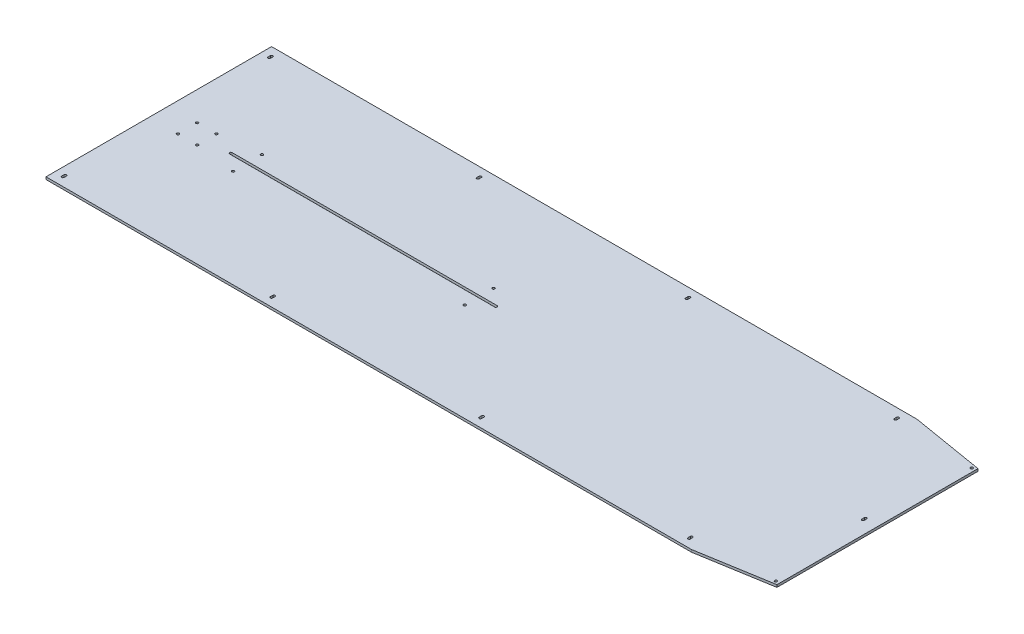
from build123d import *

# Parameters (mm, degrees)
BOSS_EXTRUDE1_DEPTH             = 6.35
F_1_4_0_25_DIAMETER_SLOT2_DEPTH = 6.35
CUT_EXTRUDE2_REACH              = 1094.5
F_0_257_DIAMETER_HOLE3_D        = 6.5278
F_0_257_DIAMETER_HOLE2_D        = 6.5278
SKETCH32_W                      = 708.025
SKETCH32_H                      = 6.5278
CUT_EXTRUDE5_DEPTH              = 1090.446092058
FILLET3_R                       = 3.175
F_0_257_DIAMETER_HOLE1_D        = 6.5278


# Read off the part's stored shape, not the designer's step: 1/4 (0.25) Diameter Slot2
with BuildPart() as part:
    # Sketch1 → Boss-Extrude1 (new body)
    with BuildSketch(Plane(origin=(0, 0, 0), x_dir=(1, 0, 0), z_dir=(0, 1, 0))):
        Polygon((854.075, 298.45), (1050.925, 265.508607402), (1050.925, -265.508607402), (854.075, -298.45), (-854.075, -298.45), (-854.075, 298.45), align=None)
    extrude(amount=BOSS_EXTRUDE1_DEPTH)

    # 1/4 (0.25) Diameter Slot2 outline → 1/4 (0.25) Diameter Slot2 (cut)
    with BuildSketch(Plane(origin=(0, 0, 0), x_dir=(1, 0, 0), z_dir=(0, 1, 0))):
        with BuildLine():
            ThreePointArc((1016, 3.175), (1012.825, 6.35), (1009.65, 3.175))
            Line((1009.65, 3.175), (1009.65, -3.175))
            ThreePointArc((1009.65, -3.175), (1012.825, -6.35), (1016, -3.175))
            Line((1016, -3.175), (1016, 3.175))
        make_face()
        with BuildLine():
            ThreePointArc((828.675, 276.225), (825.5, 279.4), (822.325, 276.225))
            Line((822.325, 276.225), (822.325, 269.875))
            ThreePointArc((822.325, 269.875), (825.5, 266.7), (828.675, 269.875))
            Line((828.675, 269.875), (828.675, 276.225))
        make_face()
        with BuildLine():
            Line((828.675, -276.225), (828.675, -269.875))
            ThreePointArc((828.675, -269.875), (825.5, -266.7), (822.325, -269.875))
            Line((822.325, -269.875), (822.325, -276.225))
            ThreePointArc((822.325, -276.225), (825.5, -279.4), (828.675, -276.225))
        make_face()
        with BuildLine():
            ThreePointArc((276.225, 276.225), (273.05, 279.4), (269.875, 276.225))
            Line((269.875, 276.225), (269.875, 269.875))
            ThreePointArc((269.875, 269.875), (273.05, 266.7), (276.225, 269.875))
            Line((276.225, 269.875), (276.225, 276.225))
        make_face()
        with BuildLine():
            Line((276.225, -276.225), (276.225, -269.875))
            ThreePointArc((276.225, -269.875), (273.05, -266.7), (269.875, -269.875))
            Line((269.875, -269.875), (269.875, -276.225))
            ThreePointArc((269.875, -276.225), (273.05, -279.4), (276.225, -276.225))
        make_face()
        with BuildLine():
            ThreePointArc((-276.225, 276.225), (-279.4, 279.4), (-282.575, 276.225))
            Line((-282.575, 276.225), (-282.575, 269.875))
            ThreePointArc((-282.575, 269.875), (-279.4, 266.7), (-276.225, 269.875))
            Line((-276.225, 269.875), (-276.225, 276.225))
        make_face()
        with BuildLine():
            Line((-276.225, -276.225), (-276.225, -269.875))
            ThreePointArc((-276.225, -269.875), (-279.4, -266.7), (-282.575, -269.875))
            Line((-282.575, -269.875), (-282.575, -276.225))
            ThreePointArc((-282.575, -276.225), (-279.4, -279.4), (-276.225, -276.225))
        make_face()
        with BuildLine():
            ThreePointArc((-828.675, 276.225), (-831.85, 279.4), (-835.025, 276.225))
            Line((-835.025, 276.225), (-835.025, 269.875))
            ThreePointArc((-835.025, 269.875), (-831.85, 266.7), (-828.675, 269.875))
            Line((-828.675, 269.875), (-828.675, 276.225))
        make_face()
        with BuildLine():
            Line((-828.675, -276.225), (-828.675, -269.875))
            ThreePointArc((-828.675, -269.875), (-831.85, -266.7), (-835.025, -269.875))
            Line((-835.025, -269.875), (-835.025, -276.225))
            ThreePointArc((-835.025, -276.225), (-831.85, -279.4), (-828.675, -276.225))
        make_face()
    extrude(amount=F_1_4_0_25_DIAMETER_SLOT2_DEPTH, mode=Mode.SUBTRACT)

    # Sketch18 → Cut-Extrude2 (cut, up to next)
    with BuildSketch(Plane(origin=(0, 6.35, 0), x_dir=(1, 0, 0), z_dir=(0, 1, 0)), mode=Mode.PRIVATE) as cut_extrude2_sk1:
        Polygon((1047.75, -266.039920186), (1050.925, -265.508607402), (1050.925, 265.508607402), (1047.75, 266.039920186), align=None)
    cut_extrude2_tool1 = extrude(cut_extrude2_sk1.sketch, amount=-CUT_EXTRUDE2_REACH, mode=Mode.PRIVATE) & part.part
    add(cut_extrude2_tool1.solids().sort_by_distance((1049.336971, 6.35, 0))[0], mode=Mode.SUBTRACT)

    # F (0.257) Diameter Hole3 (through all)
    with Locations(Plane(origin=(0, 6.35, 0), x_dir=(1, 0, 0), z_dir=(0, 1, 0))):
        with Locations((1038.225, -259.127502839), (1038.225, 259.127502839)):
            Hole(F_0_257_DIAMETER_HOLE3_D / 2)

    # F (0.257) Diameter Hole2 (through all)
    with Locations(Plane(origin=(0, 0, 0), x_dir=(-1, 0, 0), z_dir=(0, -1, 0))):
        with Locations((777.875, 25.4), (777.875, -25.4), (727.075, -25.4), (727.075, 25.4)):
            Hole(F_0_257_DIAMETER_HOLE2_D / 2)

    # Sketch32 → Cut-Extrude5 (cut, through all)
    with BuildSketch(Plane.XZ):
        with Locations((-312.7375, 0)):
            Rectangle(SKETCH32_W, SKETCH32_H)
    extrude(amount=-CUT_EXTRUDE5_DEPTH, mode=Mode.SUBTRACT)

    # Fillet3
    fillet3_edges = [part.edges().sort_by_distance(p)[0] for p in [
        (41.275, 3.175, 3.2639),
        (41.275, 3.175, -3.2639),
        (-666.75, 3.175, -3.2639),
        (-666.75, 3.175, 3.2639),
    ]]
    fillet(fillet3_edges, radius=FILLET3_R)

    # F (0.257) Diameter Hole1 (through all)
    with Locations(Plane(origin=(0, 0, 0), x_dir=(-1, 0, 0), z_dir=(0, -1, 0))):
        with Locations((619.125, 38.1), (6.35, 38.1), (619.125, -38.1), (6.35, -38.1)):
            Hole(F_0_257_DIAMETER_HOLE1_D / 2)


solid = part.part
